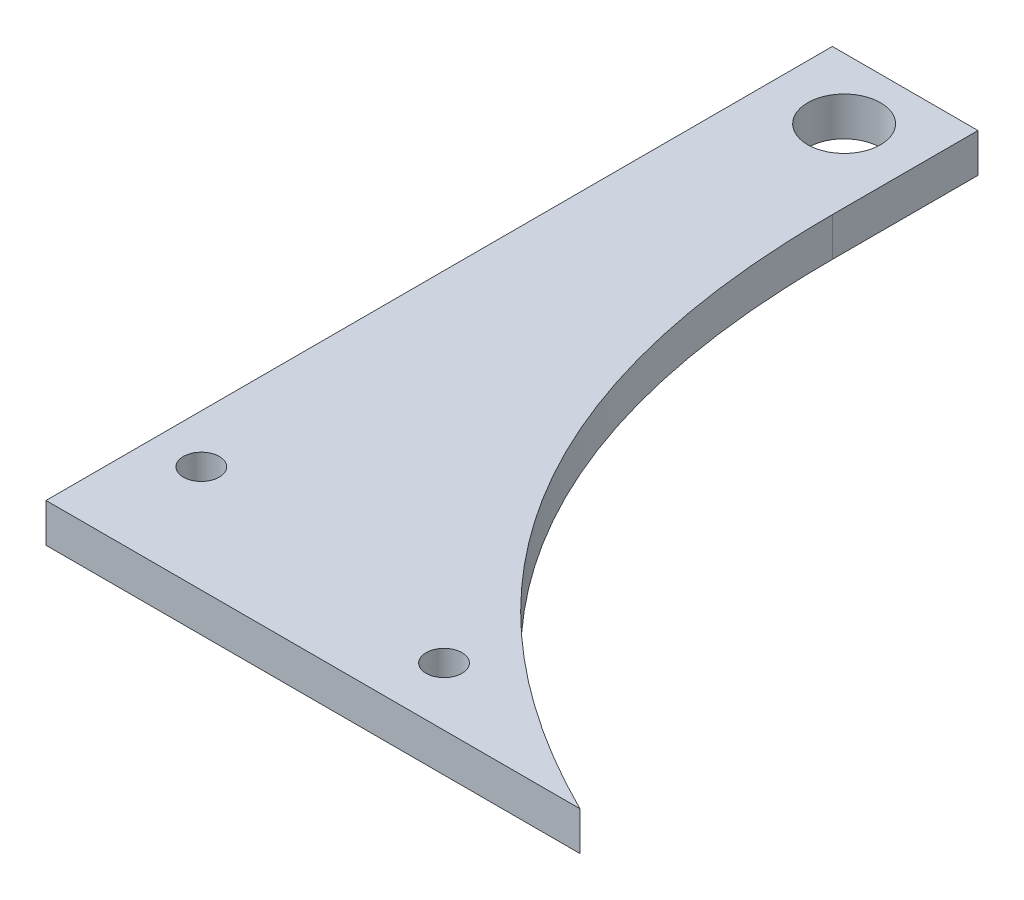
from build123d import *

# Parameters (mm, degrees)
SKETCH1_R           = 4.7625
BOSS_EXTRUDE1_DEPTH = 5.08
SKETCH3_R           = 2.3495
CUT_EXTRUDE1_DEPTH  = 82.106181478


with BuildPart() as part:
    # Sketch1 → Boss-Extrude1 (new body)
    with BuildSketch(Plane(origin=(0, 0, 0), x_dir=(1, 0, 0), z_dir=(0, 1, 0))):
        with BuildLine():
            Line((-9.525, 53.975), (9.525, 53.975))
            Line((9.525, 53.975), (9.525, 34.925))
            add(Edge.make_bspline(
                [(60.325, -48.895), (9.525, -23.638289587), (9.525, 34.925)],
                knots=[0, 0, 0, 1, 1, 1], degree=2))
            Line((60.325, -48.895), (-9.525, -48.895))
            Line((-9.525, -48.895), (-9.525, 53.975))
        make_face()
        with Locations((0, 45.9867)):
            Circle(SKETCH1_R, mode=Mode.SUBTRACT)
    extrude(amount=BOSS_EXTRUDE1_DEPTH)

    # Sketch3 → Cut-Extrude1 (cut, through all)
    with BuildSketch(Plane(origin=(0, 5.08, 0), x_dir=(1, 0, 0), z_dir=(0, 1, 0))):
        with Locations((34.925, -41.275)):
            Circle(SKETCH3_R)
        with Locations((-3.175, -34.925)):
            Circle(SKETCH3_R)
    extrude(amount=-CUT_EXTRUDE1_DEPTH, mode=Mode.SUBTRACT)


solid = part.part
